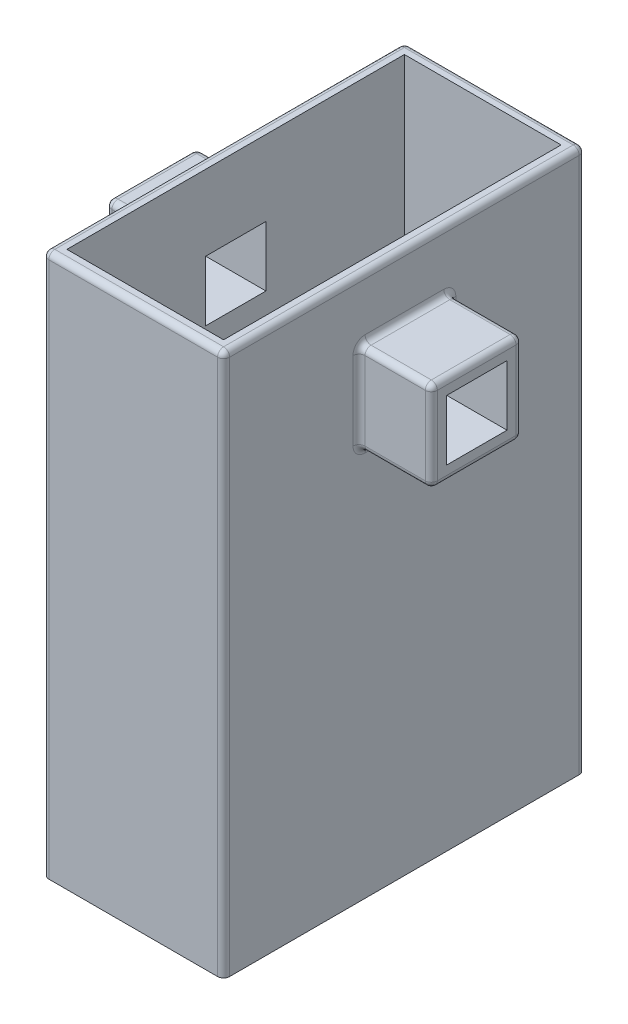
from build123d import *

# Parameters (mm, degrees)
SKETCH1_W           = 300
SKETCH1_H           = 900
BOSS_EXTRUDE1_DEPTH = 600
SKETCH4_W           = 150.6
SKETCH4_H           = 150
BOSS_EXTRUDE3_DEPTH = 120
SKETCH6_W           = 150.6
SKETCH6_H           = 150
BOSS_EXTRUDE4_DEPTH = 120
FILLET1_R           = 10
FILLET2_R           = 10
FILLET3_R           = 10
FILLET5_R           = 10
FILLET6_R           = 10
SKETCH8_W           = 260
SKETCH8_H           = 560
CUT_EXTRUDE1_DEPTH  = 1161.344776349
SKETCH7_W           = 100.6
SKETCH7_H           = 100
CUT_EXTRUDE2_DEPTH  = 1209.966500777


with BuildPart() as part:
    # Sketch1 → Boss-Extrude1 (new body)
    with BuildSketch(Plane.XY):
        with Locations((150, -450)):
            Rectangle(SKETCH1_W, SKETCH1_H)
    extrude(amount=-BOSS_EXTRUDE1_DEPTH)

    # Sketch4 → Boss-Extrude3 (add)
    with BuildSketch(Plane(origin=(300, 0, 0), x_dir=(0, 0, -1), z_dir=(1, 0, 0))):
        with Locations((300, -175)):
            Rectangle(SKETCH4_W, SKETCH4_H)
    extrude(amount=BOSS_EXTRUDE3_DEPTH)

    # Sketch6 → Boss-Extrude4 (add)
    with BuildSketch(Plane.ZY):
        with Locations((-300, -175)):
            Rectangle(SKETCH6_W, SKETCH6_H)
    extrude(amount=BOSS_EXTRUDE4_DEPTH)

    # Fillet1
    fillet1_edges = [part.edges().sort_by_distance(p)[0] for p in [
        (300, -450, -600),
        (0, -450, -600),
        (0, 0, -300),
    ]]
    fillet(fillet1_edges, radius=FILLET1_R)

    # Fillet2
    fillet2_edges = [part.edges().sort_by_distance(p)[0] for p in [
        (0, -175, -224.7),
        (-60, -250, -224.7),
        (0, -100, -300),
        (-60, -100, -224.7),
        (0, -175, -375.3),
        (-60, -100, -375.3),
        (0, -250, -300),
        (-60, -250, -375.3),
        (-120, -175, -224.7),
        (-120, -100, -300),
        (-120, -175, -375.3),
        (-120, -250, -300),
    ]]
    fillet(fillet2_edges, radius=FILLET2_R)

    # Fillet3
    fillet3_edges = [part.edges().sort_by_distance(p)[0] for p in [
        (300, -175, -375.3),
        (360, -250, -375.3),
        (300, -100, -300),
        (360, -100, -375.3),
        (300, -175, -224.7),
        (360, -100, -224.7),
        (300, -250, -300),
        (360, -250, -224.7),
        (420, -175, -375.3),
        (420, -100, -300),
        (420, -175, -224.7),
        (420, -250, -300),
    ]]
    fillet(fillet3_edges, radius=FILLET3_R)

    # Fillet5
    # the kernel refuses this fillet: 10 mm, written as the material it takes off along each edge
    with BuildSketch(Plane(origin=(10, -10, -590), x_dir=(0, 0, -1), z_dir=(0, 1, 0))) as fillet5_piece_1_section:
        Polygon((0, 0), (FILLET5_R, 0), (FILLET5_R, FILLET5_R), (0, FILLET5_R), align=None)
    fillet5_piece_1 = extrude(amount=FILLET5_R, mode=Mode.PRIVATE)
    fillet5_piece_1 = fillet5_piece_1 - Plane(origin=(10, -10, -590), x_dir=(0.7071067811865475, 0, 0.7071067811865475), z_dir=(0, 1, 0)) * Sphere(FILLET5_R, mode=Mode.PRIVATE)
    add(fillet5_piece_1, mode=Mode.SUBTRACT)
    with BuildSketch(Plane(origin=(300, 0, 25), x_dir=(0, -1, 0), z_dir=(0, 0, -1))) as fillet5_piece_2:
        with BuildLine():
            CenterArc((FILLET5_R, FILLET5_R), FILLET5_R, 180, 90)
            Line((0, FILLET5_R), (0, 0))
            Line((0, 0), (FILLET5_R, 0))
        make_face()
    extrude(amount=615, mode=Mode.SUBTRACT)
    with BuildSketch(Plane(origin=(10, 0, -600), x_dir=(0, 0, 1), z_dir=(1, 0, 0))) as fillet5_piece_3:
        with BuildLine():
            CenterArc((FILLET5_R, FILLET5_R), FILLET5_R, 180, 90)
            Line((0, FILLET5_R), (0, 0))
            Line((0, 0), (FILLET5_R, 0))
        make_face()
    extrude(amount=280, mode=Mode.SUBTRACT)
    with BuildSketch(Plane(origin=(290, 0, -590), x_dir=(1, 0, 0), z_dir=(0, 0, 1))) as fillet5_piece_4:
        with BuildLine():
            CenterArc((10 - FILLET5_R, -FILLET5_R), FILLET5_R, 0, 90)
            Line((10, -FILLET5_R), (10, 0))
            Line((10, 0), (10 - FILLET5_R, 0))
        make_face()
    revolve(axis=Axis((290, 0, -590), (0, 1, 0)), revolution_arc=90, mode=Mode.SUBTRACT)

    # Fillet6
    fillet6_edges = [part.edges().sort_by_distance(p)[0] for p in [
        (150, 0, 0),
        (297.071067812, -2.928932188, 0),
        (0, -455, 0),
        (2.928932188, -2.928932188, 0),
        (300, -455, 0),
    ]]
    fillet(fillet6_edges, radius=FILLET6_R)

    # Sketch8 → Cut-Extrude1 (cut, through all)
    with BuildSketch(Plane.XZ.offset(900)):
        with Locations((150, -300)):
            Rectangle(SKETCH8_W, SKETCH8_H)
    extrude(amount=-CUT_EXTRUDE1_DEPTH, mode=Mode.SUBTRACT)

    # Sketch7 → Cut-Extrude2 (cut, through all)
    with BuildSketch(Plane.ZY.offset(120)):
        with Locations((-300, -175)):
            Rectangle(SKETCH7_W, SKETCH7_H)
    extrude(amount=-CUT_EXTRUDE2_DEPTH, mode=Mode.SUBTRACT)


solid = part.part
